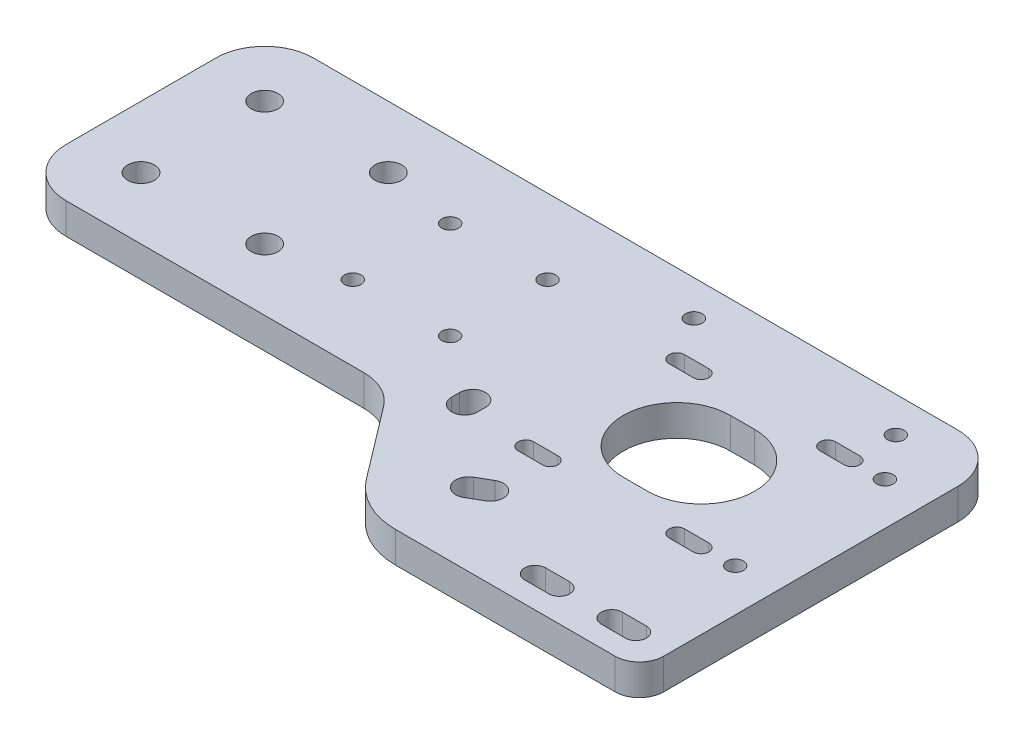
from build123d import *

# Parameters (mm, degrees)
BOSS_EXTRUDE1_DEPTH  = 6.35
M5_CLEARANCE_HOLE1_D = 5.5
M3_CLEARANCE_HOLE1_D = 3.4
CUT_EXTRUDE1_DEPTH   = 125.954644266
CUT_EXTRUDE2_DEPTH   = 125.954644266
FILLET1_R            = 10
CUT_EXTRUDE3_DEPTH   = 125.954644266
M3_CLEARANCE_HOLE2_D = 3.4
FILLET3_R            = 5


with BuildPart() as part:
    # Sketch1 → Boss-Extrude1 (new body)
    with BuildSketch(Plane(origin=(0, 0, 0), x_dir=(1, 0, 0), z_dir=(0, 1, 0))):
        with BuildLine():
            Line((38.1, -25.4), (-38.1, -25.4))
            Line((-38.1, -25.4), (-38.1, 25.4))
            Line((-38.1, 25.4), (38.1, 25.4))
            Line((38.1, 25.4), (114.321209859, 25.4))
            Line((114.321209859, 25.4), (114.321209859, -50.04))
            Line((114.321209859, -50.04), (64.241941751, -50.04))
            ThreePointArc((64.241941751, -50.04), (57.570841587, -48.474895705), (52.291870426, -44.10618968))
            Line((52.291870426, -44.10618968), (38.1, -25.4))
        make_face()
    extrude(amount=BOSS_EXTRUDE1_DEPTH)

    # M5 Clearance Hole1 (through all)
    with Locations(Plane(origin=(0, 6.35, 0), x_dir=(1, 0, 0), z_dir=(0, 1, 0))):
        with Locations((-25.4, 12.7), (0, 12.7), (0, -12.7), (-25.4, -12.7)):
            Hole(M5_CLEARANCE_HOLE1_D / 2)

    # M3 Clearance Hole1 (through all)
    with Locations(Plane(origin=(0, 6.35, 0), x_dir=(1, 0, 0), z_dir=(0, 1, 0))):
        with Locations((15.4, 10), (35.4, 10), (35.4, -10), (15.4, -10)):
            Hole(M3_CLEARANCE_HOLE1_D / 2)

    # Sketch6 → Cut-Extrude1 (cut, through all)
    with BuildSketch(Plane(origin=(0, 6.35, 0), x_dir=(1, 0, 0), z_dir=(0, 1, 0))):
        with BuildLine():
            Line((62.821209859, 7.54), (67.821209859, 7.54))
            ThreePointArc((67.821209859, 7.54), (69.421209859, 9.14), (67.821209859, 10.74))
            Line((67.821209859, 10.74), (62.821209859, 10.74))
            ThreePointArc((62.821209859, 10.74), (61.221209859, 9.14), (62.821209859, 7.54))
        make_face()
        with BuildLine():
            Line((62.821209859, -23.46), (67.821209859, -23.46))
            ThreePointArc((67.821209859, -23.46), (69.421209859, -21.86), (67.821209859, -20.26))
            Line((67.821209859, -20.26), (62.821209859, -20.26))
            ThreePointArc((62.821209859, -20.26), (61.221209859, -21.86), (62.821209859, -23.46))
        make_face()
        with BuildLine():
            Line((93.821209859, -23.46), (98.821209859, -23.46))
            ThreePointArc((98.821209859, -23.46), (100.421209859, -21.86), (98.821209859, -20.26))
            Line((98.821209859, -20.26), (93.821209859, -20.26))
            ThreePointArc((93.821209859, -20.26), (92.221209859, -21.86), (93.821209859, -23.46))
        make_face()
        with BuildLine():
            Line((93.821209859, 7.54), (98.821209859, 7.54))
            ThreePointArc((98.821209859, 7.54), (100.421209859, 9.14), (98.821209859, 10.74))
            Line((98.821209859, 10.74), (93.821209859, 10.74))
            ThreePointArc((93.821209859, 10.74), (92.221209859, 9.14), (93.821209859, 7.54))
        make_face()
        with BuildLine():
            Line((78.321209859, -17.36), (83.321209859, -17.36))
            ThreePointArc((83.321209859, -17.36), (94.321209859, -6.36), (83.321209859, 4.64))
            Line((83.321209859, 4.64), (78.321209859, 4.64))
            ThreePointArc((78.321209859, 4.64), (67.321209859, -6.36), (78.321209859, -17.36))
        make_face()
    extrude(amount=-CUT_EXTRUDE1_DEPTH, mode=Mode.SUBTRACT)

    # Sketch7 → Cut-Extrude2 (cut, through all)
    with BuildSketch(Plane(origin=(0, 6.35, 0), x_dir=(1, 0, 0), z_dir=(0, 1, 0))):
        with BuildLine():
            Line((65.751764766, -31.105892862), (62.915452987, -32.745892862))
            ThreePointArc((62.915452987, -32.745892862), (61.947834614, -36.366488764), (65.568430515, -37.334107138))
            Line((65.568430515, -37.334107138), (68.404742294, -35.694107138))
            ThreePointArc((68.404742294, -35.694107138), (69.372360668, -32.073511236), (65.751764766, -31.105892862))
        make_face()
        with BuildLine():
            Line((46.45, -19.08), (46.45, -20.72))
            ThreePointArc((46.45, -20.72), (49.1, -23.37), (51.75, -20.72))
            Line((51.75, -20.72), (51.75, -19.08))
            ThreePointArc((51.75, -19.08), (49.1, -16.43), (46.45, -19.08))
        make_face()
    extrude(amount=-CUT_EXTRUDE2_DEPTH, mode=Mode.SUBTRACT)

    # Fillet1
    fillet1_edges = [part.edges().sort_by_distance(p)[0] for p in [
        (114.321209859, 3.175, -25.4),
        (38.1, 3.175, 25.4),
        (-38.1, 3.175, -25.4),
        (-38.1, 3.175, 25.4),
    ]]
    fillet(fillet1_edges, radius=FILLET1_R)

    # Sketch8 → Cut-Extrude3 (cut, through all)
    with BuildSketch(Plane(origin=(0, 6.35, 0), x_dir=(1, 0, 0), z_dir=(0, 1, 0))):
        with BuildLine():
            Line((107.171209859, -41.46), (102.221209859, -41.46))
            ThreePointArc((102.221209859, -41.46), (100.071209859, -43.61), (102.221209859, -45.76))
            Line((102.221209859, -45.76), (107.171209859, -45.76))
            ThreePointArc((107.171209859, -45.76), (109.321209859, -43.61), (107.171209859, -41.46))
        make_face()
        with BuildLine():
            Line((86.471209859, -45.76), (91.421209859, -45.76))
            ThreePointArc((91.421209859, -45.76), (93.571209859, -43.61), (91.421209859, -41.46))
            Line((91.421209859, -41.46), (86.471209859, -41.46))
            ThreePointArc((86.471209859, -41.46), (84.321209859, -43.61), (86.471209859, -45.76))
        make_face()
    extrude(amount=-CUT_EXTRUDE3_DEPTH, mode=Mode.SUBTRACT)

    # M3 Clearance Hole2 (through all)
    with Locations(Plane(origin=(0, 6.35, 0), x_dir=(1, 0, 0), z_dir=(0, 1, 0))):
        with Locations((57.321209859, 18.14), (98.821209859, 18.14), (105.566578641, 9.14), (105.566578641, -21.61)):
            Hole(M3_CLEARANCE_HOLE2_D / 2)

    # Fillet3
    fillet3_edges = [part.edges().sort_by_distance(p)[0] for p in [
        (114.321209859, 3.175, 50.04),
    ]]
    fillet(fillet3_edges, radius=FILLET3_R)


solid = part.part
